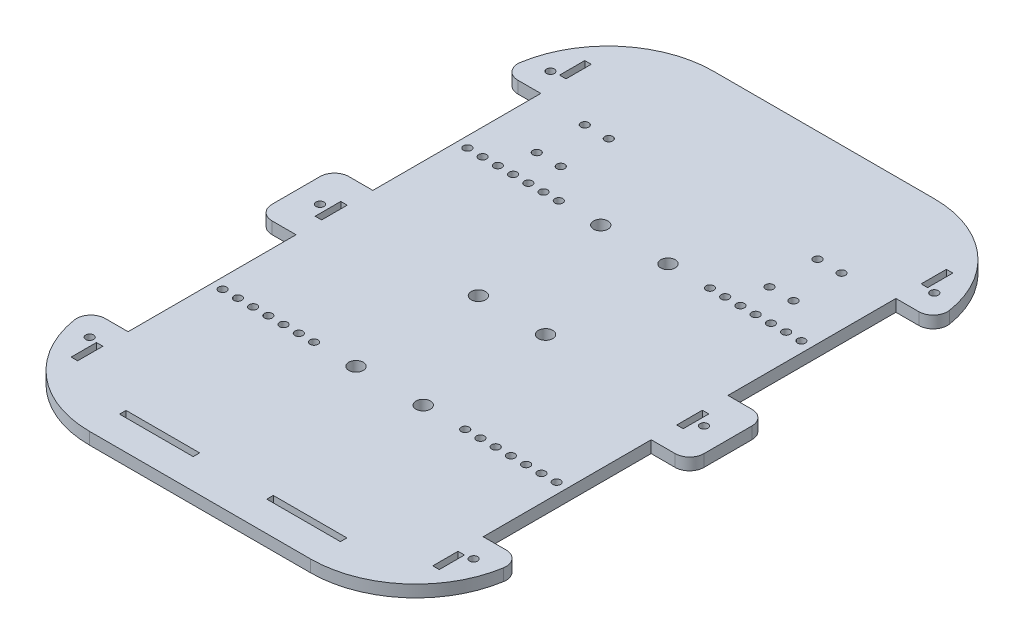
from build123d import *

# Parameters (mm, degrees)
SKETCH2_W           = 2.7
SKETCH2_H           = 10.51
SKETCH2_H_2         = 10.666666666
SKETCH2_W_2         = 30.68
SKETCH2_H_3         = 2.7
BOSS_EXTRUDE4_DEPTH = 5
SKETCH5_R           = 1.65
SKETCH5_R_2         = 3
CUT_EXTRUDE1_DEPTH  = 159.192920196


with BuildPart() as part:
    # Sketch2 → Boss-Extrude4 (new body)
    with BuildSketch(Plane(origin=(0, 0, 0), x_dir=(1, 0, 0), z_dir=(0, 1, 0))):
        with BuildLine():
            Line((46, -130), (-46, -130))
            ThreePointArc((-46, -130), (-74.550970119, -119.478980051), (-89.448061775, -92.947368421))
            ThreePointArc((-89.448061775, -92.947368421), (-88.08864154, -88.106685893), (-83.523326079, -86))
            Line((-83.523326079, -86), (-74, -86))
            Line((-74, -86), (-74, -16))
            Line((-74, -16), (-84, -16))
            ThreePointArc((-84, -16), (-88.242640687, -14.242640687), (-90, -10))
            Line((-90, -10), (-90, 10))
            ThreePointArc((-90, 10), (-88.242640687, 14.242640687), (-84, 16))
            Line((-84, 16), (-74, 16))
            Line((-74, 16), (-74, 86))
            Line((-74, 86), (-83.523326079, 86))
            ThreePointArc((-83.523326079, 86), (-88.08864154, 88.106685893), (-89.448061775, 92.947368421))
            ThreePointArc((-89.448061775, 92.947368421), (-74.550970119, 119.478980051), (-46, 130))
            Line((-46, 130), (46, 130))
            ThreePointArc((46, 130), (74.550970119, 119.478980051), (89.448061775, 92.947368421))
            ThreePointArc((89.448061775, 92.947368421), (88.08864154, 88.106685893), (83.523326079, 86))
            Line((83.523326079, 86), (74, 86))
            Line((74, 86), (74, 16))
            Line((74, 16), (84, 16))
            ThreePointArc((84, 16), (88.242640687, 14.242640687), (90, 10))
            Line((90, 10), (90, -10))
            ThreePointArc((90, -10), (88.242640687, -14.242640687), (84, -16))
            Line((84, -16), (74, -16))
            Line((74, -16), (74, -86))
            Line((74, -86), (83.523326079, -86))
            ThreePointArc((83.523326079, -86), (88.08864154, -88.106685893), (89.448061775, -92.947368421))
            ThreePointArc((89.448061775, -92.947368421), (74.550970119, -119.478980051), (46, -130))
        make_face()
        with Locations((-75.35, 101.765)):
            Rectangle(SKETCH2_W, SKETCH2_H, mode=Mode.SUBTRACT)
        with Locations((75.35, 101.765)):
            Rectangle(SKETCH2_W, SKETCH2_H, mode=Mode.SUBTRACT)
        with Locations((75.35, -101.765)):
            Rectangle(SKETCH2_W, SKETCH2_H, mode=Mode.SUBTRACT)
        with Locations((-75.35, -101.765)):
            Rectangle(SKETCH2_W, SKETCH2_H, mode=Mode.SUBTRACT)
        with Locations((-75.35, 0)):
            Rectangle(SKETCH2_W, SKETCH2_H_2, mode=Mode.SUBTRACT)
        with Locations((75.35, 0)):
            Rectangle(SKETCH2_W, SKETCH2_H_2, mode=Mode.SUBTRACT)
        with Locations((30.68, -116.18)):
            Rectangle(SKETCH2_W_2, SKETCH2_H_3, mode=Mode.SUBTRACT)
        with Locations((-30.68, -116.18)):
            Rectangle(SKETCH2_W_2, SKETCH2_H_3, mode=Mode.SUBTRACT)
    extrude(amount=BOSS_EXTRUDE4_DEPTH)

    # Sketch5 → Cut-Extrude1 (cut, through all)
    with BuildSketch(Plane(origin=(0, 5, 0), x_dir=(1, 0, 0), z_dir=(0, 1, 0))):
        with Locations((-69.6, -51)):
            Circle(SKETCH5_R)
        with Locations((-63.25, -51)):
            Circle(SKETCH5_R)
        with Locations((-56.9, -51)):
            Circle(SKETCH5_R)
        with Locations((-50.55, -51)):
            Circle(SKETCH5_R)
        with Locations((-44.2, -51)):
            Circle(SKETCH5_R)
        with Locations((-37.85, -51)):
            Circle(SKETCH5_R)
        with Locations((-31.5, -51)):
            Circle(SKETCH5_R)
        with Locations((31.5, -51)):
            Circle(SKETCH5_R)
        with Locations((37.85, -51)):
            Circle(SKETCH5_R)
        with Locations((44.2, -51)):
            Circle(SKETCH5_R)
        with Locations((50.55, -51)):
            Circle(SKETCH5_R)
        with Locations((56.9, -51)):
            Circle(SKETCH5_R)
        with Locations((63.25, -51)):
            Circle(SKETCH5_R)
        with Locations((69.6, -51)):
            Circle(SKETCH5_R)
        with Locations((69.6, 51)):
            Circle(SKETCH5_R)
        with Locations((63.25, 51)):
            Circle(SKETCH5_R)
        with Locations((56.9, 51)):
            Circle(SKETCH5_R)
        with Locations((50.55, 51)):
            Circle(SKETCH5_R)
        with Locations((44.2, 51)):
            Circle(SKETCH5_R)
        with Locations((37.85, 51)):
            Circle(SKETCH5_R)
        with Locations((31.5, 51)):
            Circle(SKETCH5_R)
        with Locations((-31.5, 51)):
            Circle(SKETCH5_R)
        with Locations((-37.85, 51)):
            Circle(SKETCH5_R)
        with Locations((-44.2, 51)):
            Circle(SKETCH5_R)
        with Locations((-50.55, 51)):
            Circle(SKETCH5_R)
        with Locations((-56.9, 51)):
            Circle(SKETCH5_R)
        with Locations((-63.25, 51)):
            Circle(SKETCH5_R)
        with Locations((-69.6, 51)):
            Circle(SKETCH5_R)
        with Locations((-14, -51)):
            Circle(SKETCH5_R_2)
        with Locations((14, -51)):
            Circle(SKETCH5_R_2)
        with Locations((14, 51)):
            Circle(SKETCH5_R_2)
        with Locations((-14, 51)):
            Circle(SKETCH5_R_2)
        with Locations((-14, 0)):
            Circle(SKETCH5_R_2)
        with Locations((14, 0)):
            Circle(SKETCH5_R_2)
        with Locations((-80, 96)):
            Circle(SKETCH5_R)
        with Locations((-80, 0)):
            Circle(SKETCH5_R)
        with Locations((80, 0)):
            Circle(SKETCH5_R)
        with Locations((-80, -96)):
            Circle(SKETCH5_R)
        with Locations((80, -96)):
            Circle(SKETCH5_R)
        with Locations((80, 96)):
            Circle(SKETCH5_R)
        with Locations((-53.5, 83.83)):
            Circle(SKETCH5_R)
        with Locations((-53.5, 63.83)):
            Circle(SKETCH5_R)
        with Locations((-43.5, 63.83)):
            Circle(SKETCH5_R)
        with Locations((-43.5, 83.83)):
            Circle(SKETCH5_R)
        with Locations((43.5, 63.83)):
            Circle(SKETCH5_R)
        with Locations((53.5, 63.83)):
            Circle(SKETCH5_R)
        with Locations((43.5, 83.83)):
            Circle(SKETCH5_R)
        with Locations((53.5, 83.83)):
            Circle(SKETCH5_R)
    extrude(amount=-CUT_EXTRUDE1_DEPTH, mode=Mode.SUBTRACT)


solid = part.part
